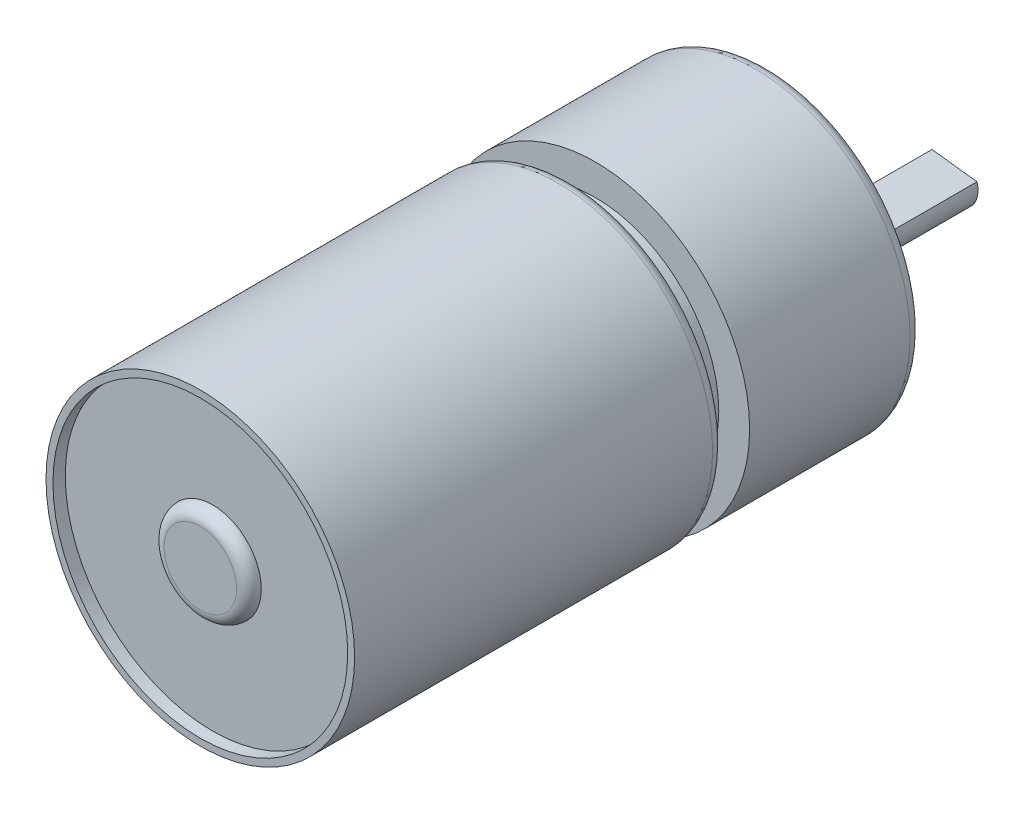
from build123d import *

# Parameters (mm, degrees)
SKETCH1_R               = 12.5
BOSS_EXTRUDE1_DEPTH     = 14
SKETCH2_R               = 10
BOSS_EXTRUDE2_DEPTH     = 2
SKETCH3_R               = 12.5
BOSS_EXTRUDE3_DEPTH     = 30
SKETCH4_R               = 11.938790889
CUT_EXTRUDE1_DEPTH      = 1
SKETCH5_R               = 3.938949389
BOSS_EXTRUDE4_DEPTH     = 1
FILLET1_R               = 1
FILLET2_R               = 1
FILLET3_R               = 1
SKETCH6_R               = 1
CUT_EXTRUDE2_DEPTH      = 5
SKETCH7_R               = 4.25
BOSS_EXTRUDE5_DEPTH     = 3
FILLET4_R               = 0.5
SKETCH8_R               = 2
BOSS_EXTRUDE6_DEPTH     = 12
CUT_EXTRUDE3_DEPTH      = 64.509841777
CUT_EXTRUDE3_DEPTH_BACK = 9


with BuildPart() as part:
    # Sketch1 → Boss-Extrude1 (new body)
    with BuildSketch(Plane.XY):
        Circle(SKETCH1_R)
    extrude(amount=BOSS_EXTRUDE1_DEPTH)

    # Sketch2 → Boss-Extrude2 (add)
    with BuildSketch(Plane.XY.offset(14)):
        Circle(SKETCH2_R)
    extrude(amount=BOSS_EXTRUDE2_DEPTH)

    # Sketch3 → Boss-Extrude3 (add)
    with BuildSketch(Plane.XY.offset(16)):
        Circle(SKETCH3_R)
    extrude(amount=BOSS_EXTRUDE3_DEPTH)

    # Sketch4 → Cut-Extrude1 (cut)
    with BuildSketch(Plane.XY.offset(46)):
        Circle(SKETCH4_R)
    extrude(amount=-CUT_EXTRUDE1_DEPTH, mode=Mode.SUBTRACT)

    # Sketch5 → Boss-Extrude4 (add)
    with BuildSketch(Plane.XY.offset(45)):
        Circle(SKETCH5_R)
    extrude(amount=BOSS_EXTRUDE4_DEPTH)

    # Fillet1
    fillet1_edges = [part.edges().sort_by_distance(p)[0] for p in [
        (-3.938949389, 0, 46),
    ]]
    fillet(fillet1_edges, radius=FILLET1_R - 0.0001)  # a hair under: the kernel refuses the full size

    # Fillet2
    fillet2_edges = [part.edges().sort_by_distance(p)[0] for p in [
        (-12.5, 0, 0),
    ]]
    fillet(fillet2_edges, radius=FILLET2_R)

    # Fillet3
    fillet3_edges = [part.edges().sort_by_distance(p)[0] for p in [
        (-12.5, 0, 16),
        (-10, 0, 16),
    ]]
    fillet(fillet3_edges, radius=FILLET3_R)

    # Sketch6 → Cut-Extrude2 (cut)
    with BuildSketch(Plane(origin=(0, 0, 0), x_dir=(-1, 0, 0), z_dir=(0, 0, -1))):
        with Locations((-9.5, 0)):
            Circle(SKETCH6_R)
        with Locations((9.5, 0)):
            Circle(SKETCH6_R)
    extrude(amount=-CUT_EXTRUDE2_DEPTH, mode=Mode.SUBTRACT)

    # Sketch7 → Boss-Extrude5 (add)
    with BuildSketch(Plane(origin=(0, 0, 0), x_dir=(-1, 0, 0), z_dir=(0, 0, -1))):
        with Locations(Location((0, -3, 0), (0, 0, 180))):
            Circle(SKETCH7_R)
    extrude(amount=BOSS_EXTRUDE5_DEPTH)

    # Fillet4
    fillet4_edges = [part.edges().sort_by_distance(p)[0] for p in [
        (-4.25, -3, -3),
    ]]
    fillet(fillet4_edges, radius=FILLET4_R)

    # Sketch8 → Boss-Extrude6 (add)
    with BuildSketch(Plane(origin=(0, 0, -3), x_dir=(-1, 0, 0), z_dir=(0, 0, -1))):
        with Locations((0, -3)):
            Circle(SKETCH8_R)
    extrude(amount=BOSS_EXTRUDE6_DEPTH)

    # Sketch9 → Cut-Extrude3 (cut, two sides: drawn at the far end of the back side and taken through both)
    with BuildSketch(Plane(origin=(0, 0, -15), x_dir=(-1, 0, 0), z_dir=(0, 0, -1)).offset(-CUT_EXTRUDE3_DEPTH_BACK)):
        Polygon((-53.075925999, -8.559326208), (-1.919066235, -2.436808394), (1.731963356, -1.999848545), (52.88882312, 4.122669269), (40.643787491, 106.436388797), (-65.320961628, 93.754393319), align=None)
    extrude(amount=CUT_EXTRUDE3_DEPTH + CUT_EXTRUDE3_DEPTH_BACK, mode=Mode.SUBTRACT)


solid = part.part
